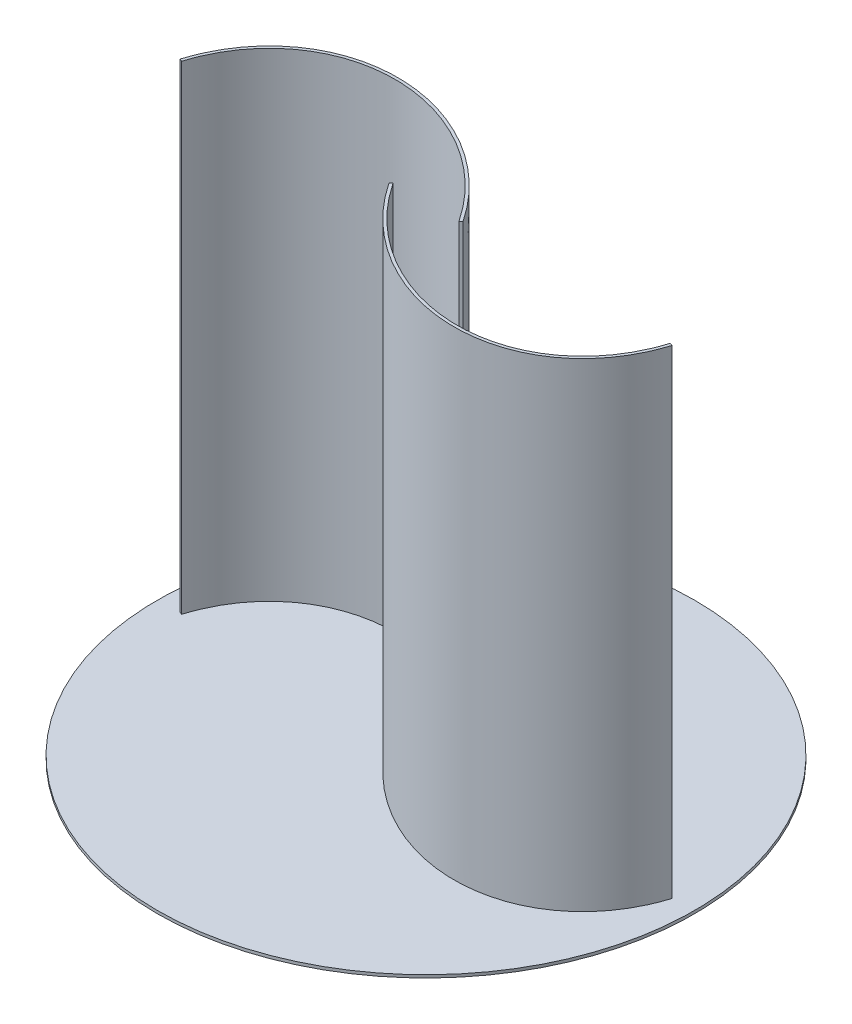
from build123d import *

# Parameters (mm, degrees)
EXTRUIR_L_MINA1_DEPTH      = 500
CROQUIS2_R                 = 280.5
SALIENTE_EXTRUIR8_DEPTH    = 3
S_LIDO_MOVER_COPIAR1_ANGLE = 90
S_LIDO_MOVER_COPIAR4_ANGLE = 30
S_LIDO_MOVER_COPIAR5_ANGLE = 60


# Read off the part's stored shape, not the designer's step: Extruir-Lámina1
with BuildPart() as part:
    # Extruir-Lámina1 outline → Extruir-Lámina1 (new body)
    with BuildSketch(Plane(origin=(0, 0, 0), x_dir=(1, 0, 0), z_dir=(0, 1, 0))):
        with BuildLine():
            Line((34.425, 0), (36.922383395, 1.662250336))
            add(Edge.make_bspline(
                [(36.922383395, 1.662250336), (32.114544874, 8.885600411), (26.905707559, 15.848675795), (15.77978911, 29.128734644), (9.862765944, 35.445648919), (-2.573209928, 47.319017813), (-9.092098682, 52.875411067), (-22.614867545, 63.126659856), (-29.61867993, 67.821462762), (-43.985718131, 76.263455135), (-51.348874868, 80.010600631), (-66.302445601, 86.487652294), (-73.892791198, 89.217521701), (-89.164074387, 93.608048941), (-96.844944698, 95.268674387), (-112.158137305, 97.487420153), (-119.790390592, 98.045509366), (-134.866763518, 98.045509366), (-142.310805471, 97.487390167), (-156.872894422, 95.261841654), (-163.990846835, 93.594390609), (-177.767174385, 89.178401002), (-184.4254365, 86.429864216), (-197.156200497, 79.901643935), (-203.228583717, 76.122000799), (-214.672346426, 67.602645169), (-220.04362509, 62.863012804), (-229.984260691, 52.514070792), (-234.553552685, 46.904864224), (-242.80616442, 34.923654513), (-246.48945543, 28.551755016), (-252.904271235, 15.165345538), (-255.635790384, 8.150927099), (-257.867887256, 0.88046731)],
                knots=[0, 0, 0, 0, 0.0625, 0.0625, 0.125, 0.125, 0.1875, 0.1875, 0.25, 0.25, 0.3125, 0.3125, 0.375, 0.375, 0.4375, 0.4375, 0.5, 0.5, 0.5625, 0.5625, 0.625, 0.625, 0.6875, 0.6875, 0.75, 0.75, 0.8125, 0.8125, 0.875, 0.875, 0.9375, 0.9375, 1, 1, 1, 1], degree=3))
            Line((-257.867887256, 0.88046731), (-255, 0))
            add(Edge.make_bspline(
                [(34.425, 0), (-163.641209274, 297.576876047), (-255, 0)],
                knots=[1.541766118, 1.541766118, 1.541766118, 3.706390506, 3.706390506, 3.706390506], degree=2, weights=[1, 0.469287849, 1]))
        make_face()
        with BuildLine():
            Line((-34.425, 0), (-36.922383395, -1.662250336))
            add(Edge.make_bspline(
                [(-36.922383395, -1.662250336), (-32.114544874, -8.885600411), (-26.905707559, -15.848675795), (-15.77978911, -29.128734644), (-9.862765944, -35.445648919), (2.573209928, -47.319017813), (9.092098682, -52.875411067), (22.614867545, -63.126659856), (29.61867993, -67.821462762), (43.985718131, -76.263455135), (51.348874868, -80.010600631), (66.302445601, -86.487652294), (73.892791198, -89.217521701), (89.164074387, -93.608048941), (96.844944698, -95.268674387), (112.158137305, -97.487420153), (119.790390592, -98.045509366), (134.866763518, -98.045509366), (142.310805471, -97.487390167), (156.872894422, -95.261841654), (163.990846835, -93.594390609), (177.767174385, -89.178401002), (184.4254365, -86.429864216), (197.156200497, -79.901643935), (203.228583717, -76.122000799), (214.672346426, -67.602645169), (220.04362509, -62.863012804), (229.984260691, -52.514070792), (234.553552685, -46.904864224), (242.80616442, -34.923654513), (246.48945543, -28.551755016), (252.904271235, -15.165345538), (255.635790384, -8.150927099), (257.867887256, -0.88046731)],
                knots=[0, 0, 0, 0, 0.0625, 0.0625, 0.125, 0.125, 0.1875, 0.1875, 0.25, 0.25, 0.3125, 0.3125, 0.375, 0.375, 0.4375, 0.4375, 0.5, 0.5, 0.5625, 0.5625, 0.625, 0.625, 0.6875, 0.6875, 0.75, 0.75, 0.8125, 0.8125, 0.875, 0.875, 0.9375, 0.9375, 1, 1, 1, 1], degree=3))
            Line((257.867887256, -0.88046731), (255, 0))
            add(Edge.make_bspline(
                [(-34.425, 0), (163.641209274, -297.576876047), (255, 0)],
                knots=[1.541766118, 1.541766118, 1.541766118, 3.706390506, 3.706390506, 3.706390506], degree=2, weights=[1, 0.469287849, 1]))
        make_face()
    extrude(amount=EXTRUIR_L_MINA1_DEPTH)

    # Croquis2 → Saliente-Extruir8 (add)
    with BuildSketch(Plane.XZ):
        with Locations(Location((0, 0, 0), (0, 0, 270))):
            Circle(CROQUIS2_R)
    extrude(amount=SALIENTE_EXTRUIR8_DEPTH)


with BuildPart() as part_1:
    # Sólido-Mover/Copiar1: moved
    add(part.part.rotate(Axis((0, 0, 0), (0, -1, 0)), S_LIDO_MOVER_COPIAR1_ANGLE))


with BuildPart() as part_2:
    # Sólido-Mover/Copiar4: moved
    add(part_1.part.rotate(Axis((0, 0, 0), (0, 1, 0)), S_LIDO_MOVER_COPIAR4_ANGLE))


with BuildPart() as part_3:
    # Sólido-Mover/Copiar5: moved
    add(part_2.part.rotate(Axis((0, 0, 0), (0, 1, 0)), S_LIDO_MOVER_COPIAR5_ANGLE))


solid = part_3.part
